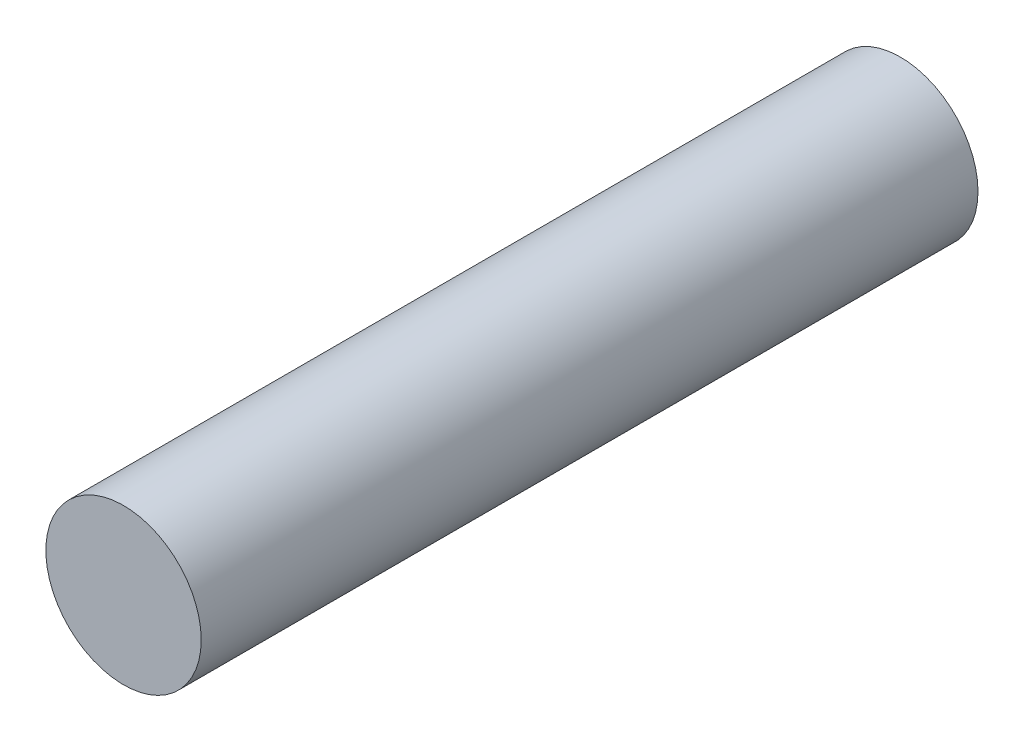
from build123d import *

# Parameters (mm, degrees)
SKETCH1_R           = 15
BOSS_EXTRUDE1_DEPTH = 150


with BuildPart() as part:
    # Sketch1 → Boss-Extrude1 (new body)
    with BuildSketch(Plane.XY):
        Circle(SKETCH1_R)
    extrude(amount=BOSS_EXTRUDE1_DEPTH)


solid = part.part
